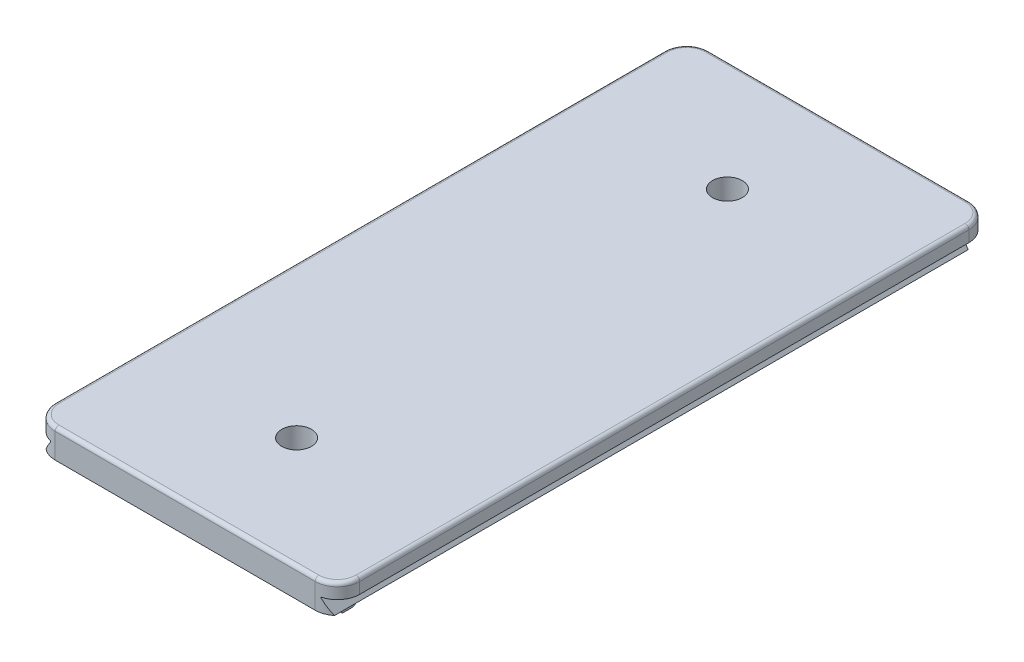
from build123d import *

# Parameters (mm, degrees)
BOSS_EXTRUDE1_DEPTH = 86
SKETCH2_W           = 41
SKETCH2_H           = 2
BOSS_EXTRUDE2_DEPTH = 2
SKETCH3_W           = 38.84033909
SKETCH3_H           = 2
BOSS_EXTRUDE3_DEPTH = 0.25
FILLET2_R           = 0.5
FILLET1_R           = 3
CUT_EXTRUDE1_REACH  = 92.449
SKETCH4_R           = 2
FILLET3_R           = 0.5


with BuildPart() as part:
    # Sketch1 → Boss-Extrude1 (new body)
    with BuildSketch(Plane.XY):
        Polygon((18.194806353, 26), (19.420169545, 24.25), (-19.420169545, 24.25), (-18.194806353, 26), (-18.194806353, 26.1), (-20.5, 26.1), (-20.5, 28.1), (20.5, 28.1), (20.5, 26.1), (18.194806353, 26.1), align=None)
    extrude(amount=-BOSS_EXTRUDE1_DEPTH)

    # Sketch2 → Boss-Extrude2 (add)
    with BuildSketch(Plane(origin=(0, 0, -86), x_dir=(-1, 0, 0), z_dir=(0, 0, -1))):
        with Locations((0, 27.1)):
            Rectangle(SKETCH2_W, SKETCH2_H)
    extrude(amount=BOSS_EXTRUDE2_DEPTH)

    # Sketch3 → Boss-Extrude3 (add)
    with BuildSketch(Plane.XZ.offset(-24.25)):
        with Locations((0, -2.5)):
            Rectangle(SKETCH3_W, SKETCH3_H)
    extrude(amount=BOSS_EXTRUDE3_DEPTH)

    # Fillet2
    # the kernel refuses this fillet: 0.5 mm, written as the material it takes off along each edge
    with BuildSketch(Plane(origin=(-20.502701299, 24, -3.5), x_dir=(0, 1, 0), z_dir=(1, 0, 0)), Plane(origin=(20.502701299, 24, -1.5), x_dir=(0, 1, 0), z_dir=(-1, 0, 0))) as fillet2_piece_1:
        with BuildLine():
            CenterArc((0.5, 0.433012702), FILLET2_R, 180, 60)
            Line((0, 0.433012702), (-0.01, 0.433012702))
            Line((-0.01, 0.433012702), (-0.01, 0))
            Line((-0.01, 0), (0, -0.01))
            ThreePointArc((0, -0.01), (0.125, -0.01), (0.245, -0.008660254))
            Line((0.245, -0.008660254), (0.25, 0))
        make_face()
    extrude(amount=41.005402599, mode=Mode.SUBTRACT)

    # Fillet1
    fillet1_edges = [part.edges().sort_by_distance(p)[0] for p in [
        (-20.5, 27.1, 0),
        (20.5, 27.1, 0),
        (-20.5, 27.1, -88),
        (20.5, 27.1, -88),
    ]]
    fillet(fillet1_edges, radius=FILLET1_R)

    # Sketch4 → Cut-Extrude1 (cut, up to next)
    with BuildSketch(Plane(origin=(0, 28.1, 0), x_dir=(1, 0, 0), z_dir=(0, 1, 0)), mode=Mode.PRIVATE) as cut_extrude1_sk1:
        with Locations(Location((0, 73, 0), (0, 0, 270))):
            Circle(SKETCH4_R)
    cut_extrude1_tool1 = extrude(cut_extrude1_sk1.sketch, amount=-CUT_EXTRUDE1_REACH, mode=Mode.PRIVATE) & part.part
    # Sketch4 → Cut-Extrude1 (cut, up to next)
    with BuildSketch(Plane(origin=(0, 28.1, 0), x_dir=(1, 0, 0), z_dir=(0, 1, 0)), mode=Mode.PRIVATE) as cut_extrude1_sk2:
        with Locations((0, 15)):
            Circle(SKETCH4_R)
    cut_extrude1_tool2 = extrude(cut_extrude1_sk2.sketch, amount=-CUT_EXTRUDE1_REACH, mode=Mode.PRIVATE) & part.part
    add(cut_extrude1_tool1.solids().sort_by_distance((0, 28.1, -73))[0], mode=Mode.SUBTRACT)
    add(cut_extrude1_tool2.solids().sort_by_distance((0, 28.1, -15))[0], mode=Mode.SUBTRACT)

    # Fillet3
    fillet3_edges = [part.edges().sort_by_distance(p)[0] for p in [
        (20.5, 28.1, -44),
        (0, 28.1, 0),
        (19.621320344, 28.1, -0.878679656),
        (-19.621320344, 28.1, -0.878679656),
        (19.621320344, 28.1, -87.121320344),
        (-19.621320344, 28.1, -87.121320344),
        (-20.5, 28.1, -44),
        (0, 28.1, -88),
    ]]
    fillet(fillet3_edges, radius=FILLET3_R)


solid = part.part
